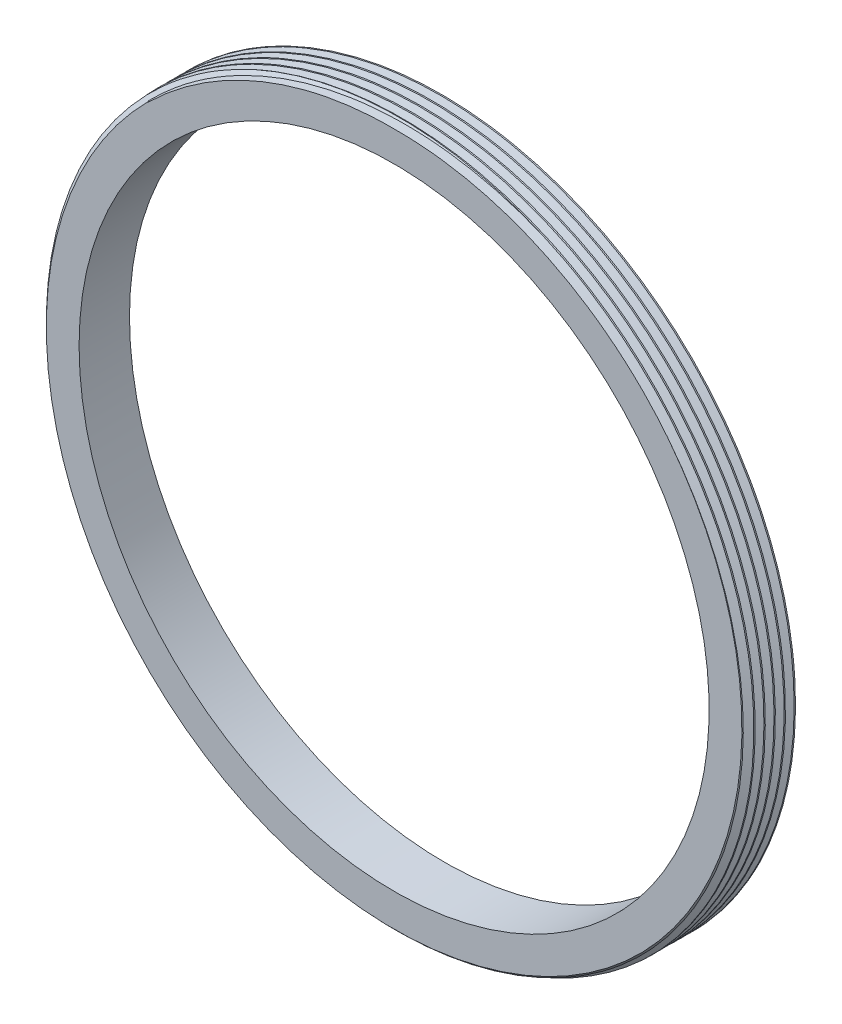
from build123d import *

# Parameters (mm, degrees)
SWEEP_1_PITCH = 2.0000000000000107


with BuildPart() as part:
    # Эскиз1 → Повернуть1 (revolve)
    with BuildSketch(Plane(origin=(0, 0, 0), x_dir=(1, 0, 0), z_dir=(0, 1, 0))):
        Polygon((-62.5, -7.65e-15), (-70, -8.57e-15), (-70, 9.999999999999995), (-62.5, 9.999999999999995), align=None)
    revolve(axis=Axis((0, 0, 0), (0, 0, 1)))

    # Вырез-По траектории1: arcs per turn and ends read off the stored shape
    # Вырез-По траектории1: the profile of Эскиз3 screwed along a right-hand helix through 11 turns, 10 arcs to a turn; built about Z, then put on its axis
    sweep_1_z = Axis((0, 0, 0), (0, 0, 1))
    sweep_1_corners = [(70.5, 1.2305e-05, 0.904700594), (70.5, 1.2305e-05, -1.404700483), (68.5, 1.1956e-05, -0.249999944)]
    with BuildLine(mode=Mode.PRIVATE) as sweep_1_profile:
        Line(sweep_1_corners[0], sweep_1_corners[1])
        Line(sweep_1_corners[1], sweep_1_corners[2])
        Line(sweep_1_corners[2], sweep_1_corners[0])
    sweep_1_cap = Face(sweep_1_profile.wire())
    sweep_1_turn_angles = [0, 18, 36, 54, 72, 90, 108, 126, 144, 162, 180, 198, 216, 234, 252, 270, 288, 306, 324, 342, 360]
    sweep_1_turn_weights = [1, 0.9510565162951535, 1, 0.9510565162951535, 1, 0.9510565162951535, 1, 0.9510565162951535, 1, 0.9510565162951535, 1, 0.9510565162951535, 1, 0.9510565162951535, 1, 0.9510565162951535, 1, 0.9510565162951535, 1, 0.9510565162951535, 1]
    sweep_1_turn_rails = [Edge.make_bspline([Vector(p[0], p[1], 0).rotate(sweep_1_z, sweep_1_turn_angles[k]) / sweep_1_turn_weights[k] + Vector(0, 0, p[2] + SWEEP_1_PITCH * sweep_1_turn_angles[k] / 360) for k in range(21)], [0, 0, 0, 1, 1, 2, 2, 3, 3, 4, 4, 5, 5, 6, 6, 7, 7, 8, 8, 9, 9, 10, 10, 10], 2, sweep_1_turn_weights) for p in sweep_1_corners]
    sweep_1_turn_sides = [Face.make_surface_from_curves(sweep_1_turn_rails[p[0]], sweep_1_turn_rails[p[1]]) for p in [(0, 1), (1, 2), (2, 0)]]
    sweep_1 = Plane(origin=(0, 0, 0), x_dir=(-0.7071067811865512, 0.7071067811865438, 0), z_dir=(0, 0, -1)) * Solid(Shell([*[p.moved(Location((0, 0, SWEEP_1_PITCH * i))) for i in range(11) for p in sweep_1_turn_sides], sweep_1_cap, sweep_1_cap.rotate(sweep_1_z, 3960).moved(Location((0, 0, SWEEP_1_PITCH * 3960 / 360)))]))
    add(sweep_1, mode=Mode.SUBTRACT)

    # Фаска1: read off the stored shape, not the designer's step
    # Фаска1 outline → Фаска1 (revolve, cut)
    with BuildSketch(Plane.XZ):
        Polygon((70, 0), (69, 0), (70, -1), align=None)
    revolve(axis=Axis((0, 0, 0), (0, 0, 1)), mode=Mode.SUBTRACT)


solid = part.part
